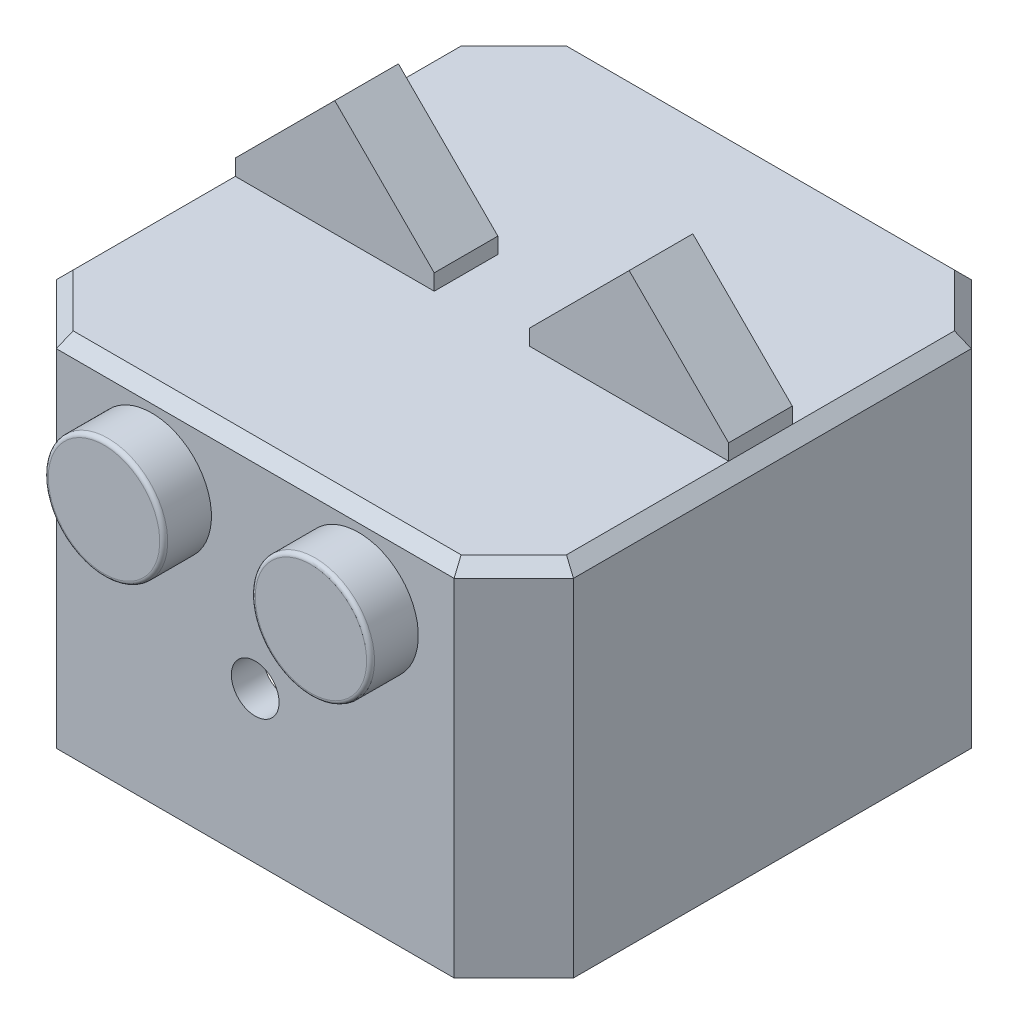
from build123d import *

# Parameters (mm, degrees)
SALIENTE_EXTRUIR1_DEPTH  = 45
VACIADO2_T               = -4
CHAFL_N3_SIZE            = 1.5
CROQUIS2_R               = 7.5
SALIENTE_EXTRUIR2_DEPTH  = 6
CROQUIS4_R               = 5
CORTAR_EXTRUIR2_DEPTH    = 5.5
REDONDEO1_R              = 0.5
CROQUIS5_R               = 3
CORTAR_EXTRUIR3_DEPTH    = 10
SALIENTE_EXTRUIR8_START  = 5.5
CROQUIS13_R              = 5
CROQUIS13_R_2            = 2.6
SALIENTE_EXTRUIR8_DEPTH  = 5.5
CROQUIS7_W               = 4
CROQUIS7_H               = 4
SALIENTE_EXTRUIR3_DEPTH  = 1
CROQUIS8_R               = 2
SALIENTE_EXTRUIR4_DEPTH  = 1
CROQUIS9_R               = 1.6
CORTAR_EXTRUIR5_DEPTH    = 2
CROQUIS10_W              = 25
CROQUIS10_H              = 8
SALIENTE_EXTRUIR5_DEPTH  = 2
SALIENTE_EXTRUIR6_DEPTH  = 8
CROQUIS12_R              = 1.15
CROQUIS12_R_2            = 0.8
SALIENTE_EXTRUIR7_DEPTH  = 6
CROQUIS14_W              = 3
CROQUIS14_H              = 2.5
SALIENTE_EXTRUIR9_DEPTH  = 5
CROQUIS15_W              = 12
CROQUIS15_H              = 8
CORTAR_EXTRUIR6_DEPTH    = 2
CROQUIS16_W              = 14.5
CROQUIS16_H              = 14.5
CROQUIS16_W_2            = 12.4
CROQUIS16_H_2            = 12.4
SALIENTE_EXTRUIR10_DEPTH = 3
CROQUIS17_R              = 5.5
CORTAR_EXTRUIR7_DEPTH    = 96.317889192


with BuildPart() as part:
    # Croquis1 → Saliente-Extruir1 (new body)
    with BuildSketch(Plane(origin=(0, 0, 0), x_dir=(1, 0, 0), z_dir=(0, 1, 0))):
        Polygon((-25, -32.5), (25, -32.5), (32.5, -25), (32.5, 25), (25, 32.5), (-25, 32.5), (-32.5, 25), (-32.5, -25), align=None)
    extrude(amount=SALIENTE_EXTRUIR1_DEPTH)

    # Vaciado2
    vaciado2_openings = [part.faces().sort_by_distance(p)[0] for p in [
        (0, 0, 0),
    ]]
    offset(amount=VACIADO2_T, openings=vaciado2_openings, kind=Kind.INTERSECTION)

    # Chaflán3
    chafl_n3_edges = [part.edges().sort_by_distance(p)[0] for p in [
        (0, 45, -32.5),
        (32.5, 45, 0),
        (0, 45, 32.5),
        (-32.5, 45, 0),
        (-28.75, 45, 28.75),
        (28.75, 45, 28.75),
        (28.75, 45, -28.75),
        (-28.75, 45, -28.75),
    ]]
    chamfer(chafl_n3_edges, length=CHAFL_N3_SIZE)

    # Croquis2 → Saliente-Extruir2 (add)
    with BuildSketch(Plane.XY.offset(32.5)):
        with Locations((13, 35)):
            Circle(CROQUIS2_R)
        with Locations((-13, 35)):
            Circle(CROQUIS2_R)
    extrude(amount=SALIENTE_EXTRUIR2_DEPTH)

    # Croquis4 → Cortar-Extruir2 (cut)
    with BuildSketch(Plane(origin=(0, 0, 28.5), x_dir=(-1, 0, 0), z_dir=(0, 0, -1))):
        with Locations((-13, 35)):
            Circle(CROQUIS4_R)
        with Locations((13, 35)):
            Circle(CROQUIS4_R)
    extrude(amount=-CORTAR_EXTRUIR2_DEPTH, mode=Mode.SUBTRACT)

    # Redondeo1
    redondeo1_edges = [part.edges().sort_by_distance(p)[0] for p in [
        (-20.5, 35, 38.5),
        (5.5, 35, 38.5),
    ]]
    fillet(redondeo1_edges, radius=REDONDEO1_R)

    # Croquis5 → Cortar-Extruir3 (cut)
    with BuildSketch(Plane.XY.offset(32.5)):
        with Locations((0, 19)):
            Circle(CROQUIS5_R)
    extrude(amount=-CORTAR_EXTRUIR3_DEPTH, mode=Mode.SUBTRACT)

    # Croquis13 → Saliente-Extruir8 (add)
    # profile 1 of 2: a face of its own
    with BuildSketch(Plane(origin=(0, 0, 34), x_dir=(-1, 0, 0), z_dir=(0, 0, -1)).offset(SALIENTE_EXTRUIR8_START)):
        with Locations((13, 35)):
            Circle(CROQUIS13_R)
        with Locations((13, 35)):
            Circle(CROQUIS13_R_2, mode=Mode.SUBTRACT)
    # profile 2 of 2: a face of its own
    with BuildSketch(Plane(origin=(0, 0, 34), x_dir=(-1, 0, 0), z_dir=(0, 0, -1)).offset(SALIENTE_EXTRUIR8_START)):
        with Locations((-13, 35)):
            Circle(CROQUIS13_R)
        with Locations((-13, 35)):
            Circle(CROQUIS13_R_2, mode=Mode.SUBTRACT)
    extrude(amount=-SALIENTE_EXTRUIR8_DEPTH)

    # Croquis7 → Saliente-Extruir3 (add)
    with BuildSketch(Plane(origin=(0, 0, 28.5), x_dir=(-1, 0, 0), z_dir=(0, 0, -1))):
        with Locations((-11.58, 10.5)):
            Rectangle(CROQUIS7_W, CROQUIS7_H)
        with Locations((-11.58, 28)):
            Rectangle(CROQUIS7_W, CROQUIS7_H)
        with Locations((11.43, 10.5)):
            Rectangle(CROQUIS7_W, CROQUIS7_H)
        with Locations((11.43, 28)):
            Rectangle(CROQUIS7_W, CROQUIS7_H)
    extrude(amount=SALIENTE_EXTRUIR3_DEPTH)

    # Croquis8 → Saliente-Extruir4 (add)
    with BuildSketch(Plane(origin=(0, 0, 27.5), x_dir=(-1, 0, 0), z_dir=(0, 0, -1))):
        with Locations((-11.505, 10.489346828)):
            Circle(CROQUIS8_R)
        with Locations((-11.505, 27.976317365)):
            Circle(CROQUIS8_R)
        with Locations((11.505, 10.489346828)):
            Circle(CROQUIS8_R)
        with Locations((11.505, 27.976317365)):
            Circle(CROQUIS8_R)
    extrude(amount=SALIENTE_EXTRUIR4_DEPTH)

    # Croquis9 → Cortar-Extruir5 (cut)
    with BuildSketch(Plane(origin=(0, 0, 26.5), x_dir=(-1, 0, 0), z_dir=(0, 0, -1))):
        with Locations((-11.505, 27.976317365)):
            Circle(CROQUIS9_R)
        with Locations((-11.505, 10.489346828)):
            Circle(CROQUIS9_R)
        with Locations((11.505, 10.489346828)):
            Circle(CROQUIS9_R)
        with Locations((11.505, 27.976317365)):
            Circle(CROQUIS9_R)
    extrude(amount=-CORTAR_EXTRUIR5_DEPTH, mode=Mode.SUBTRACT)

    # Croquis10 → Saliente-Extruir5 (add)
    with BuildSketch(Plane(origin=(0, 45, 0), x_dir=(1, 0, 0), z_dir=(0, 1, 0))):
        with Locations((-18.5, 0)):
            Rectangle(CROQUIS10_W, CROQUIS10_H)
        with Locations((18.5, 0)):
            Rectangle(CROQUIS10_W, CROQUIS10_H)
    extrude(amount=SALIENTE_EXTRUIR5_DEPTH)

    # Croquis11 → Saliente-Extruir6 (add)
    with BuildSketch(Plane.XY.offset(4)):
        Polygon((-31, 47), (-6, 47), (-18.5, 59.5), align=None)
        Polygon((31, 47), (18.5, 59.5), (6, 47), align=None)
    extrude(amount=-SALIENTE_EXTRUIR6_DEPTH)

    # Croquis12 → Saliente-Extruir7 (add)
    # profile 1 of 4: a face of its own
    with BuildSketch(Plane.XZ.offset(-41)):
        with Locations((-20.65, 7.68)):
            Circle(CROQUIS12_R)
        with Locations((-20.65, 7.68)):
            Circle(CROQUIS12_R_2, mode=Mode.SUBTRACT)
    # profile 2 of 4: a face of its own
    with BuildSketch(Plane.XZ.offset(-41)):
        with Locations((-20.65, -7.68)):
            Circle(CROQUIS12_R)
        with Locations((-20.65, -7.68)):
            Circle(CROQUIS12_R_2, mode=Mode.SUBTRACT)
    # profile 3 of 4: a face of its own
    with BuildSketch(Plane.XZ.offset(-41)):
        with Locations((20.65, 7.68)):
            Circle(CROQUIS12_R)
        with Locations((20.65, 7.68)):
            Circle(CROQUIS12_R_2, mode=Mode.SUBTRACT)
    # profile 4 of 4: a face of its own
    with BuildSketch(Plane.XZ.offset(-41)):
        with Locations((20.65, -7.68)):
            Circle(CROQUIS12_R)
        with Locations((20.65, -7.68)):
            Circle(CROQUIS12_R_2, mode=Mode.SUBTRACT)
    extrude(amount=SALIENTE_EXTRUIR7_DEPTH)

    # Croquis14 → Saliente-Extruir9 (add)
    with BuildSketch(Plane.XZ.offset(-41)):
        with Locations((-20.65, 7.68)):
            Rectangle(CROQUIS14_W, CROQUIS14_H)
        with Locations((-20.65, -7.68)):
            Rectangle(CROQUIS14_W, CROQUIS14_H)
        with Locations((20.65, 7.68)):
            Rectangle(CROQUIS14_W, CROQUIS14_H)
        with Locations((20.65, -7.68)):
            Rectangle(CROQUIS14_W, CROQUIS14_H)
    extrude(amount=SALIENTE_EXTRUIR9_DEPTH)

    # Croquis15 → Cortar-Extruir6 (cut)
    with BuildSketch(Plane.ZY.offset(32.5)):
        with Locations((0, 36.5)):
            Rectangle(CROQUIS15_W, CROQUIS15_H)
    extrude(amount=-CORTAR_EXTRUIR6_DEPTH, mode=Mode.SUBTRACT)

    # Croquis16 → Saliente-Extruir10 (add)
    with BuildSketch(Plane.XY.offset(-28.5)):
        with Locations((12.75, 12.25)):
            Rectangle(CROQUIS16_W, CROQUIS16_H)
        with Locations((12.75, 12.25)):
            Rectangle(CROQUIS16_W_2, CROQUIS16_H_2, mode=Mode.SUBTRACT)
    extrude(amount=SALIENTE_EXTRUIR10_DEPTH)

    # Croquis17 → Cortar-Extruir7 (cut, through all)
    with BuildSketch(Plane.XY.offset(-28.5)):
        with Locations((12.75, 12.25)):
            Circle(CROQUIS17_R)
    extrude(amount=-CORTAR_EXTRUIR7_DEPTH, mode=Mode.SUBTRACT)


solid = part.part
